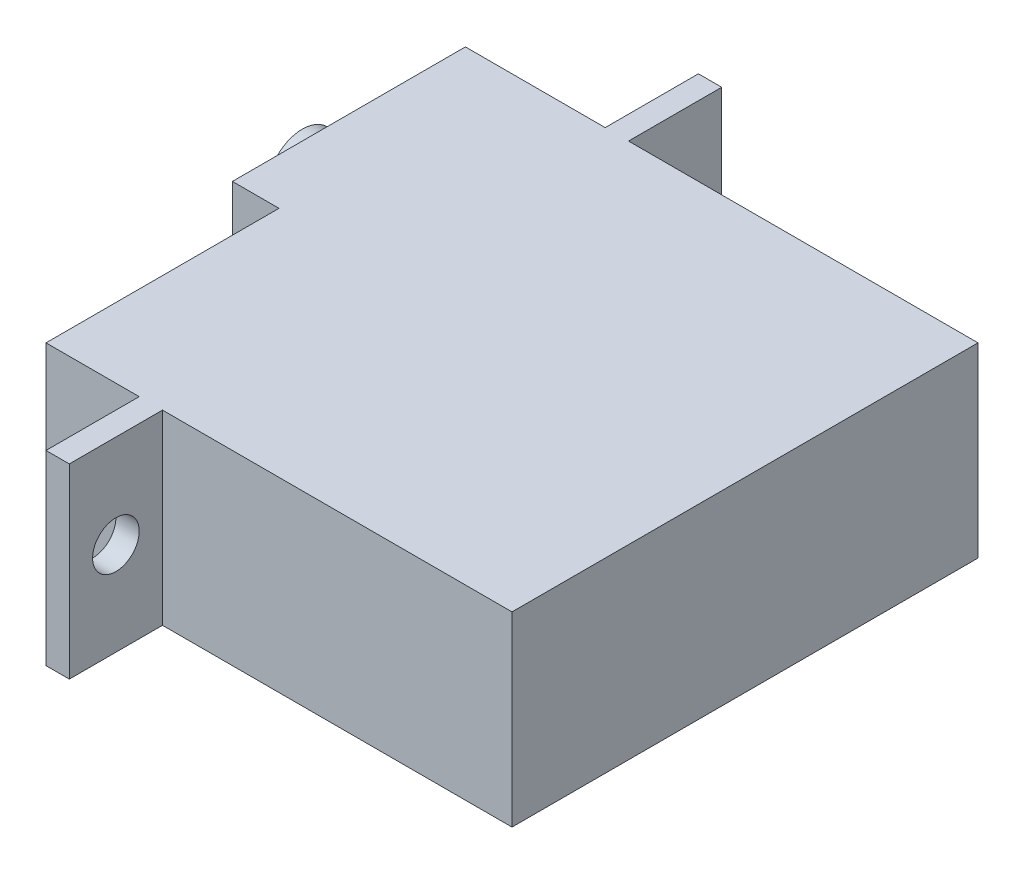
from build123d import *

# Parameters (mm, degrees)
SKETCH1_W           = 20
SKETCH1_H           = 20
BOSS_EXTRUDE1_DEPTH = 8
SKETCH2_W           = 1
SKETCH2_H           = 8
BOSS_EXTRUDE2_DEPTH = 4
SKETCH3_W           = 1
SKETCH3_H           = 8
BOSS_EXTRUDE3_DEPTH = 4
SKETCH4_R           = 1
CUT_EXTRUDE1_DEPTH  = 4
SKETCH5_W           = 10
SKETCH5_H           = 8
BOSS_EXTRUDE4_DEPTH = 2
SKETCH6_R           = 1.5
BOSS_EXTRUDE5_DEPTH = 3


with BuildPart() as part:
    # Sketch1 → Boss-Extrude1 (new body)
    with BuildSketch(Plane(origin=(0, 0, 0), x_dir=(1, 0, 0), z_dir=(0, 1, 0))):
        with Locations((10, -10)):
            Rectangle(SKETCH1_W, SKETCH1_H)
    extrude(amount=BOSS_EXTRUDE1_DEPTH)

    # Sketch2 → Boss-Extrude2 (add)
    with BuildSketch(Plane(origin=(0, 0, 0), x_dir=(-1, 0, 0), z_dir=(0, 0, -1))):
        with Locations((-4.5, 4)):
            Rectangle(SKETCH2_W, SKETCH2_H)
    extrude(amount=BOSS_EXTRUDE2_DEPTH)

    # Sketch3 → Boss-Extrude3 (add)
    with BuildSketch(Plane.XY.offset(20)):
        with Locations((4.5, 4)):
            Rectangle(SKETCH3_W, SKETCH3_H)
    extrude(amount=BOSS_EXTRUDE3_DEPTH)

    # Sketch4 → Cut-Extrude1 (cut)
    with BuildSketch(Plane.ZY.offset(-4)):
        with Locations((-2, 4)):
            Circle(SKETCH4_R)
        with Locations((22, 4)):
            Circle(SKETCH4_R)
    extrude(amount=-CUT_EXTRUDE1_DEPTH, mode=Mode.SUBTRACT)

    # Sketch5 → Boss-Extrude4 (add)
    with BuildSketch(Plane.ZY):
        with Locations((5, 4)):
            Rectangle(SKETCH5_W, SKETCH5_H)
    extrude(amount=BOSS_EXTRUDE4_DEPTH)

    # Sketch6 → Boss-Extrude5 (add)
    with BuildSketch(Plane.ZY.offset(2)):
        with Locations((4, 3.944627207)):
            Circle(SKETCH6_R)
    extrude(amount=BOSS_EXTRUDE5_DEPTH)


solid = part.part
